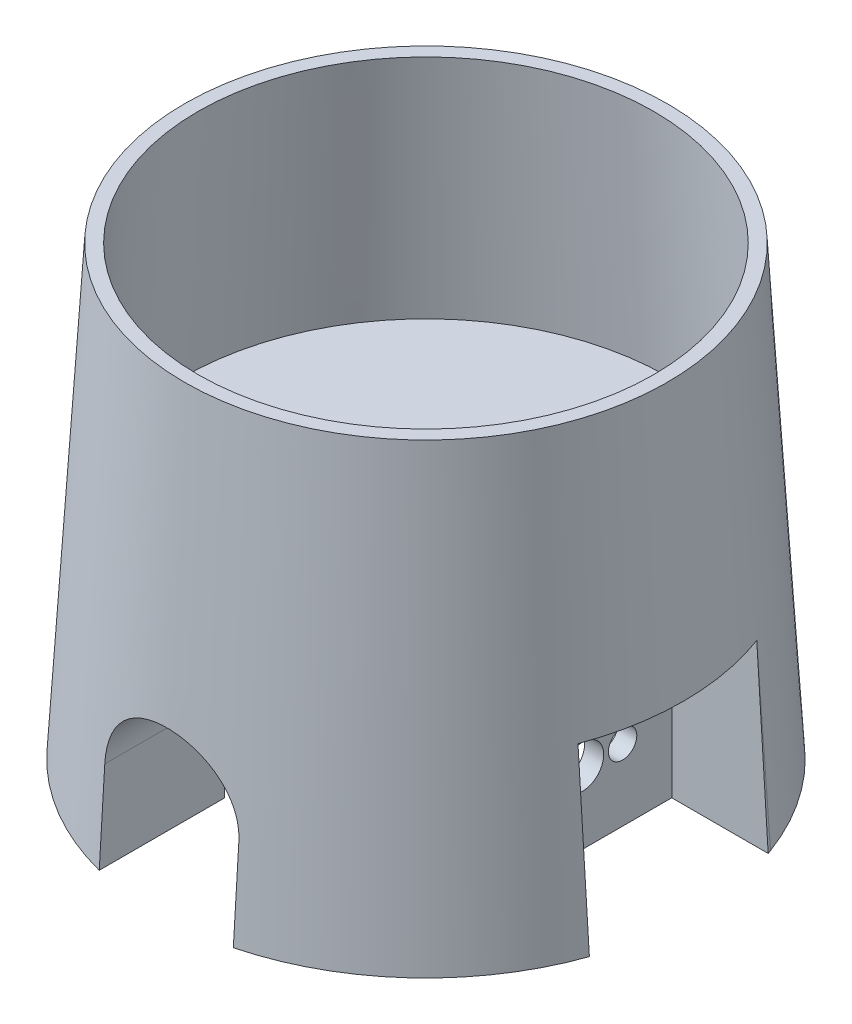
from build123d import *

# Parameters (mm, degrees)
SKETCH_5_W                          = 61.5
SKETCH_5_H                          = 60.2
CUT_EXTRUDE_1_DEPTH                 = 40
CUT_EXTRUDE_START                   = -35
SKETCH_6_W                          = 40
SKETCH_6_H                          = 40
CUT_EXTRUDE_2_DEPTH                 = 35
CUT_EXTRUDE_START_2                 = 35
SKETCH_9_W                          = 40
SKETCH_9_H                          = 40
CUT_EXTRUDE_3_DEPTH                 = 40
CUT_EXTRUDE_4_DEPTH                 = 40
F_2_5MM_1_D                         = 2.5
F_2_5MM_1_CSINK_D                   = 2.55
F_2_5MM_1_CSINK_ANGLE               = 90
CUT_EXTRUDE_START_3                 = -10
CUT_EXTRUDE_5_DEPTH                 = 10
HOLE_WIZARD_3_8_0_375_1_D           = 9.525
HOLE_WIZARD_3_8_0_375_1_CSINK_D     = 10.795
HOLE_WIZARD_3_8_0_375_1_CSINK_ANGLE = 90
HOLE_WIZARD_1_4_0_25_1_D            = 6.35
HOLE_WIZARD_1_4_0_25_1_CSINK_D      = 7.62
HOLE_WIZARD_1_4_0_25_1_CSINK_ANGLE  = 90


with BuildPart() as part:
    # 草图3 → 旋转2 (revolve)
    with BuildSketch(Plane(origin=(0, 0, 0), x_dir=(0, 0, -1), z_dir=(1, 0, 0))):
        Polygon((0, 0), (60, 0), (54, 100), (0, 100), align=None)
    revolve(axis=Axis((0, 100, 0), (0, -1, 0)))

    # 草图5 → 切除-拉伸1 (cut)
    with BuildSketch(Plane(origin=(0, 0, 0), x_dir=(-1, 0, 0), z_dir=(0, -1, 0))):
        Rectangle(SKETCH_5_W, SKETCH_5_H)
    extrude(amount=-CUT_EXTRUDE_1_DEPTH, mode=Mode.SUBTRACT)

    # 草图6 → 切除-拉伸2 (cut)
    with BuildSketch(Plane(origin=(0, 0, 0), x_dir=(0, 0, -1), z_dir=(1, 0, 0)).offset(CUT_EXTRUDE_START)):
        with Locations((0, 20)):
            Rectangle(SKETCH_6_W, SKETCH_6_H)
    extrude(amount=-CUT_EXTRUDE_2_DEPTH, mode=Mode.SUBTRACT)

    # 草图9 → 切除-拉伸3 (cut)
    with BuildSketch(Plane(origin=(0, 0, 0), x_dir=(0, 0, -1), z_dir=(1, 0, 0)).offset(CUT_EXTRUDE_START_2)):
        with Locations((0, 20)):
            Rectangle(SKETCH_9_W, SKETCH_9_H)
    extrude(amount=CUT_EXTRUDE_3_DEPTH, mode=Mode.SUBTRACT)

    # 草图10 → 切除-拉伸4 (cut)
    with BuildSketch(Plane(origin=(0, 0, 30.1), x_dir=(-1, 0, 0), z_dir=(0, 0, -1))):
        with BuildLine():
            Line((-15, 0), (-15, 20))
            ThreePointArc((-15, 20), (0, 35), (15, 20))
            Line((15, 20), (15, 0))
            Line((15, 0), (-15, 0))
        make_face()
    extrude(amount=-CUT_EXTRUDE_4_DEPTH, mode=Mode.SUBTRACT)

    # 草图11 → 切除-旋转1 (revolve, cut)
    with BuildSketch(Plane.XY):
        Polygon((-50.994604851, 100), (-54.174604851, 47), (0, 47), (0, 100), align=None)
    revolve(axis=Axis((0, 47, 0), (0, 1, 0)), mode=Mode.SUBTRACT)

    # Ø2.5mm 暗销孔1 (through all)
    with Locations(Plane(origin=(0, 47, 0), x_dir=(1, 0, 0), z_dir=(0, 1, 0))):
        with Locations((41.5, -13.5), (-10.5, 13.5), (-10.5, -13.5), (41.5, 13.5)):
            CounterSinkHole(F_2_5MM_1_D / 2, F_2_5MM_1_CSINK_D / 2, counter_sink_angle=F_2_5MM_1_CSINK_ANGLE)

    # 草图16 → 切除-拉伸5 (cut)
    with BuildSketch(Plane.XY.offset(-30.1).offset(CUT_EXTRUDE_START_3)):
        with BuildLine():
            Line((15, 20), (15, 0))
            Line((15, 0), (-15, 0))
            Line((-15, 0), (-15, 20))
            ThreePointArc((-15, 20), (0, 35), (15, 20))
        make_face()
    extrude(amount=CUT_EXTRUDE_5_DEPTH, mode=Mode.SUBTRACT)

    # 3/8 (0.375) 直径孔1 (through all)
    with Locations(Plane.ZY.offset(35)):
        with Locations((0, 16)):
            CounterSinkHole(HOLE_WIZARD_3_8_0_375_1_D / 2, HOLE_WIZARD_3_8_0_375_1_CSINK_D / 2, counter_sink_angle=HOLE_WIZARD_3_8_0_375_1_CSINK_ANGLE)

    # 1/4 (0.25) 直径孔1 (through all)
    with Locations(Plane.ZY.offset(35)):
        with Locations((9, 16), (-9, 16)):
            CounterSinkHole(HOLE_WIZARD_1_4_0_25_1_D / 2, HOLE_WIZARD_1_4_0_25_1_CSINK_D / 2, counter_sink_angle=HOLE_WIZARD_1_4_0_25_1_CSINK_ANGLE)


solid = part.part
